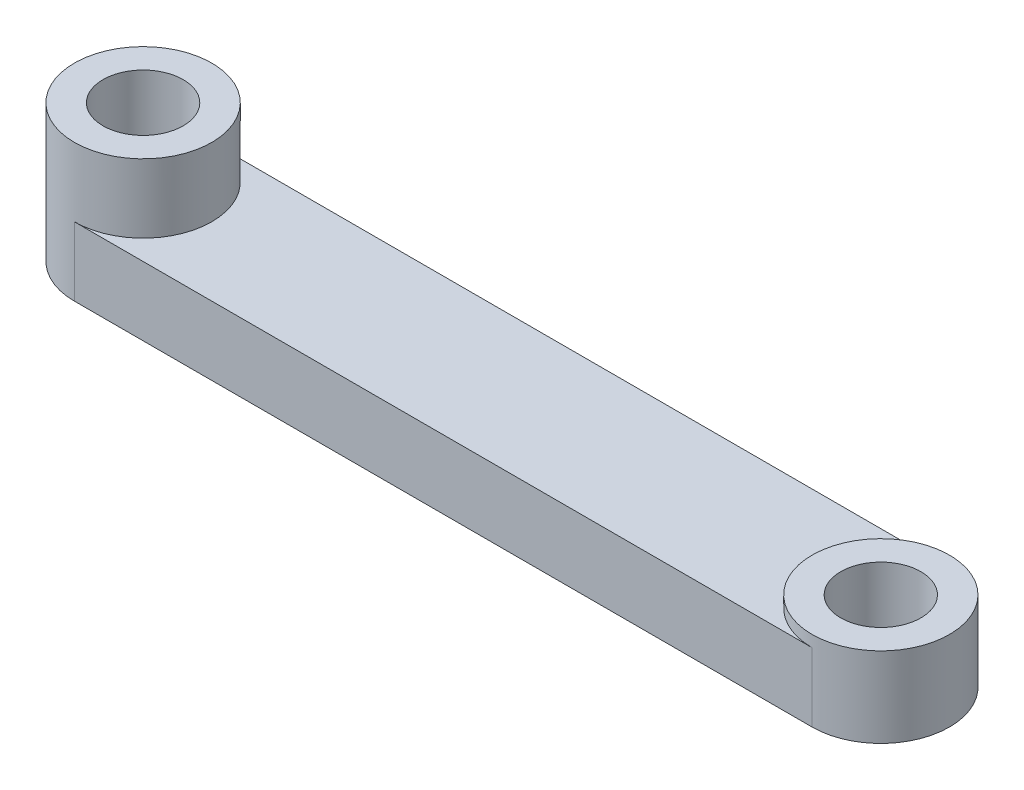
from build123d import *
from build123d.topology import SkipClean

# Parameters (mm, degrees)
EXTRUDE_1_DEPTH     = 3
SKETCH_2_R          = 3
EXTRUDE_2_DEPTH     = 0.5
SKETCH_3_R          = 3
EXTRUDE_3_DEPTH     = 3
SKETCH_4_R          = 1.75
CUT_EXTRUDE_1_DEPTH = 36.833503876


with BuildPart() as part:
    # Эскиз1 → Бобышка-Вытянуть1 (new body)
    with BuildSketch(Plane(origin=(0, 0, 0), x_dir=(1, 0, 0), z_dir=(0, 1, 0))):
        with BuildLine():
            Line((0, 3), (32.2, 3))
            ThreePointArc((32.2, 3), (35.2, 0), (32.2, -3))
            Line((32.2, -3), (0, -3))
            ThreePointArc((0, -3), (-3, 0), (0, 3))
        make_face()
    extrude(amount=EXTRUDE_1_DEPTH)

    # Эскиз2 → Бобышка-Вытянуть2 (add)
    with SkipClean():  # the faces are left unmerged after this step: merging them gives an invalid solid
        with BuildSketch(Plane(origin=(0, 3, 0), x_dir=(1, 0, 0), z_dir=(0, 1, 0))):
            with Locations((32.2, 0)):
                Circle(SKETCH_2_R)
        extrude(amount=EXTRUDE_2_DEPTH)
    add(part.part.scale(1), mode=Mode.REPLACE)  # the faces are merged on a copy

    # Эскиз3 → Бобышка-Вытянуть3 (add)
    with BuildSketch(Plane(origin=(0, 3, 0), x_dir=(1, 0, 0), z_dir=(0, 1, 0))):
        Circle(SKETCH_3_R)
    extrude(amount=EXTRUDE_3_DEPTH)

    # Эскиз4 → Вырез-Вытянуть1 (cut, through all)
    with BuildSketch(Plane(origin=(0, 6, 0), x_dir=(1, 0, 0), z_dir=(0, 1, 0))):
        Circle(SKETCH_4_R)
        with Locations((32.2, 0)):
            Circle(SKETCH_4_R)
    extrude(amount=-CUT_EXTRUDE_1_DEPTH, mode=Mode.SUBTRACT)


solid = part.part
